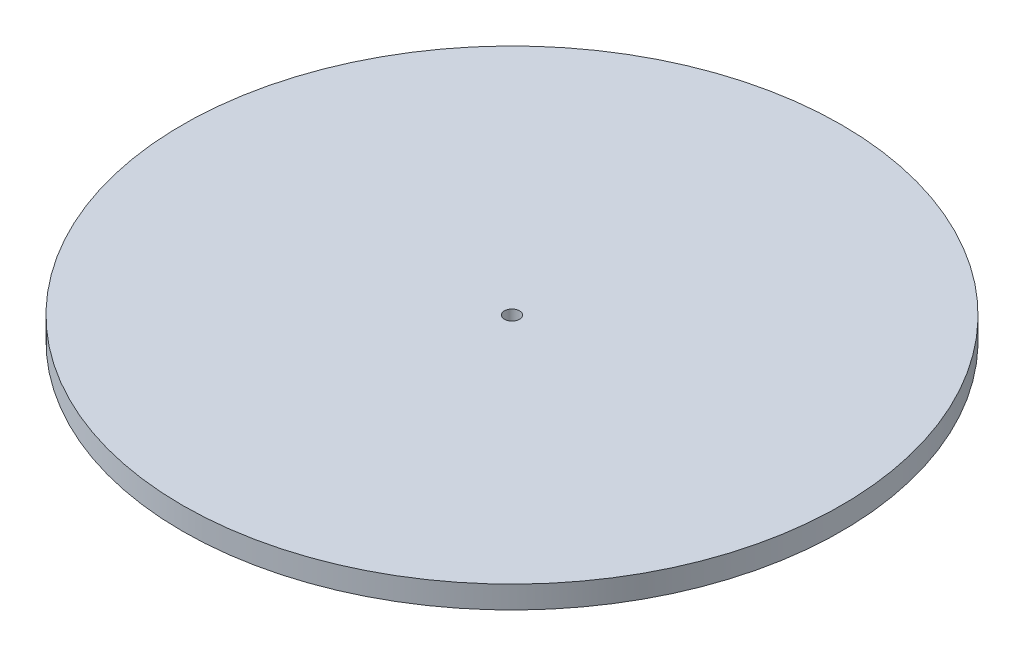
from build123d import *

# Parameters (mm, degrees)
BASEPLATE_R         = 279.945595429
BOSS_EXTRUDE1_DEPTH = 19.05
CUT_EXTRUDE1_REACH  = 398.361
CENTERHOLE_R        = 6.35


with BuildPart() as part:
    # BasePlate → Boss-Extrude1 (new body)
    with BuildSketch(Plane(origin=(0, 0, 0), x_dir=(1, 0, 0), z_dir=(0, 1, 0))):
        Circle(BASEPLATE_R)
    extrude(amount=BOSS_EXTRUDE1_DEPTH)

    # CenterHole → Cut-Extrude1 (cut, up to next)
    with BuildSketch(Plane(origin=(0, 19.05, 0), x_dir=(1, 0, 0), z_dir=(0, 1, 0)), mode=Mode.PRIVATE) as cut_extrude1_sk1:
        Circle(CENTERHOLE_R)
    cut_extrude1_tool1 = extrude(cut_extrude1_sk1.sketch, amount=-CUT_EXTRUDE1_REACH, mode=Mode.PRIVATE) & part.part
    add(cut_extrude1_tool1.solids().sort_by_distance((0, 19.05, 0))[0], mode=Mode.SUBTRACT)


solid = part.part
